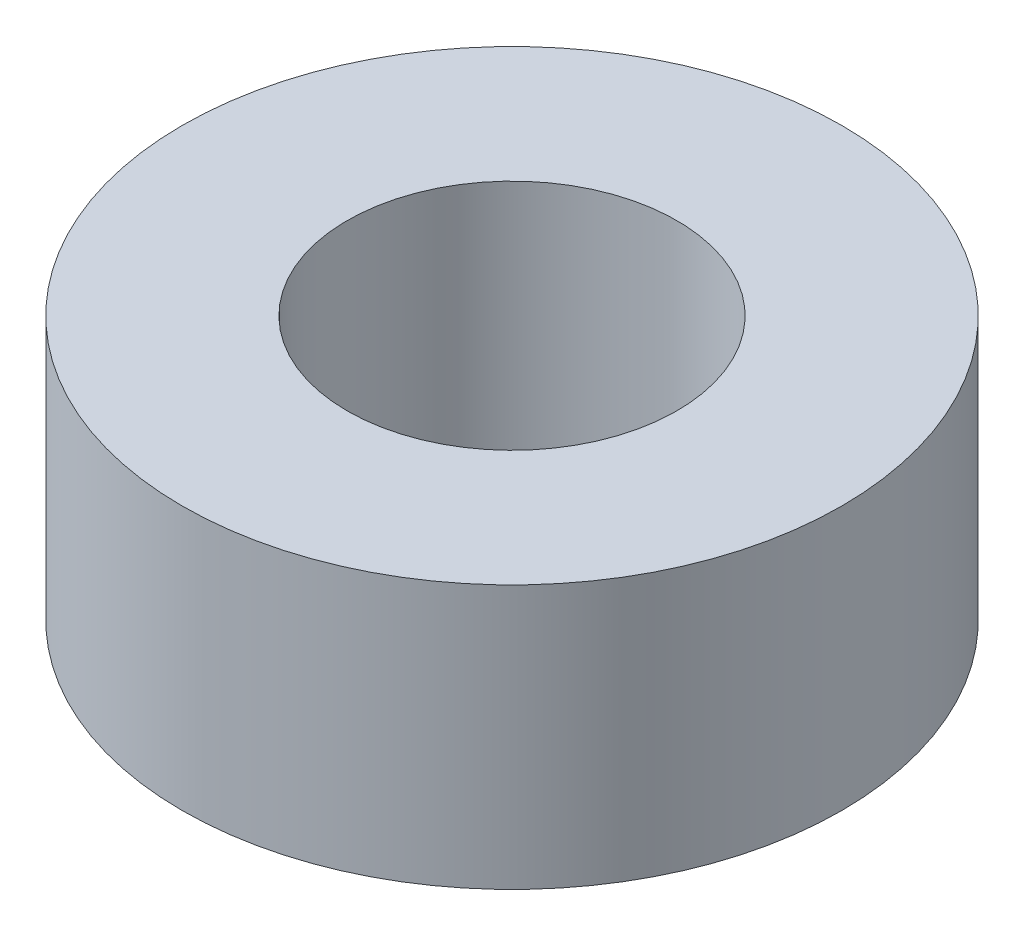
from build123d import *

# Parameters (mm, degrees)
SKETCH1_R           = 15
BOSS_EXTRUDE1_DEPTH = 12
SKETCH2_R           = 7.5
CUT_EXTRUDE1_DEPTH  = 25.372115214


with BuildPart() as part:
    # Sketch1 → Boss-Extrude1 (new body)
    with BuildSketch(Plane(origin=(0, 0, 0), x_dir=(1, 0, 0), z_dir=(0, 1, 0))):
        Circle(SKETCH1_R)
    extrude(amount=BOSS_EXTRUDE1_DEPTH)

    # Sketch2 → Cut-Extrude1 (cut, through all)
    with BuildSketch(Plane(origin=(0, 0, 0), x_dir=(1, 0, 0), z_dir=(0, 1, 0))):
        Circle(SKETCH2_R)
    extrude(amount=CUT_EXTRUDE1_DEPTH, mode=Mode.SUBTRACT)


solid = part.part
